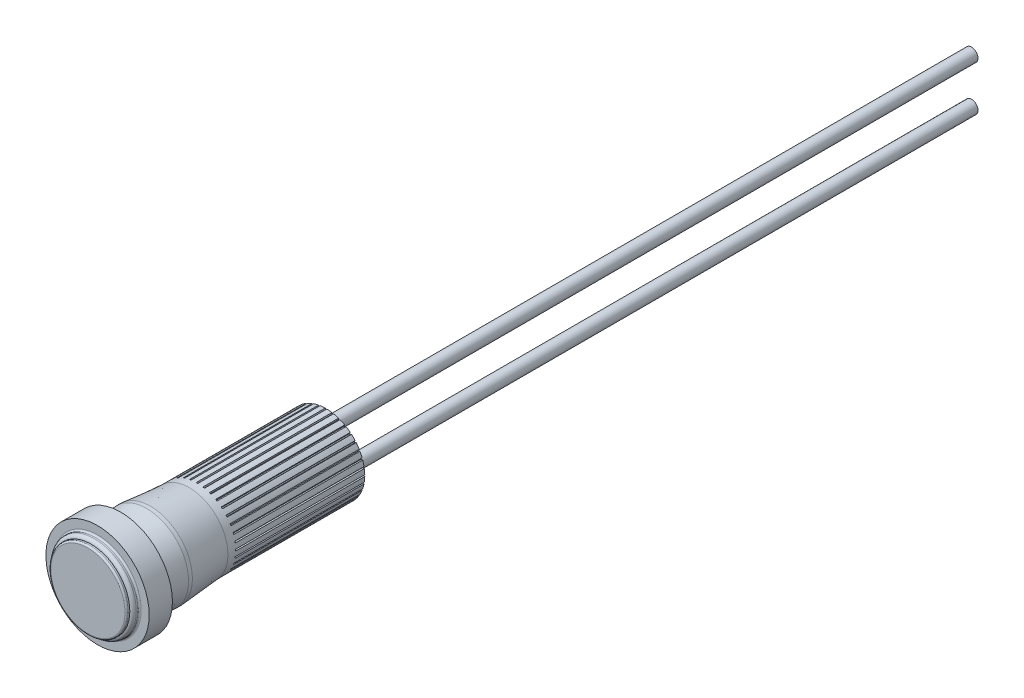
from build123d import *

# Parameters (mm, degrees)
SKETCH1_R           = 8
BOSS_EXTRUDE1_DEPTH = 5.1
CUT_EXTRUDE1_START  = -1.5
SKETCH2_R           = 8
SKETCH2_R_2         = 6.5
CUT_EXTRUDE1_DEPTH  = 1.5
SKETCH3_R           = 7
SKETCH3_R_2         = 6
CUT_EXTRUDE2_DEPTH  = 0.5
FILLET1_R           = 0.5
FILLET2_R           = 0.25
FILLET3_R           = 0.25
CUT_EXTRUDE3_DEPTH  = 20
SKETCH6_R           = 1
BOSS_EXTRUDE2_DEPTH = 100


with BuildPart() as part:
    # Sketch1 → Boss-Extrude1 (new body)
    with BuildSketch(Plane.XY):
        Circle(SKETCH1_R)
    extrude(amount=BOSS_EXTRUDE1_DEPTH)

    # Sketch2 → Cut-Extrude1 (cut)
    with BuildSketch(Plane.XY.offset(5.1).offset(CUT_EXTRUDE1_START)):
        Circle(SKETCH2_R)
        Circle(SKETCH2_R_2, mode=Mode.SUBTRACT)
    extrude(amount=CUT_EXTRUDE1_DEPTH, mode=Mode.SUBTRACT)

    # Sketch3 → Cut-Extrude2 (cut)
    with BuildSketch(Plane.XY.offset(5.1)):
        Circle(SKETCH3_R)
        Circle(SKETCH3_R_2, mode=Mode.SUBTRACT)
    extrude(amount=-CUT_EXTRUDE2_DEPTH, mode=Mode.SUBTRACT)

    # Fillet1
    fillet1_edges = [part.edges().sort_by_distance(p)[0] for p in [
        (-6.5, 0, 4.6),
    ]]
    fillet(fillet1_edges, radius=FILLET1_R - 0.0001)  # a hair under: the kernel refuses the full size

    # Fillet2
    fillet2_edges = [part.edges().sort_by_distance(p)[0] for p in [
        (-6, 0, 5.1),
    ]]
    fillet(fillet2_edges, radius=FILLET2_R)

    # Fillet3
    fillet3_edges = [part.edges().sort_by_distance(p)[0] for p in [
        (-6.5, 0, 3.6),
    ]]
    fillet(fillet3_edges, radius=FILLET3_R)

    # Sketch4 → Revolve1 (revolve)
    with BuildSketch(Plane(origin=(0, 0, 0), x_dir=(0, 0, -1), z_dir=(1, 0, 0)), mode=Mode.PRIVATE) as revolve1_sk:
        Polygon((0, 6), (4, 6.5), (4.6, 6.5), (10.6, 6), (31.8, 6), (31.8, 0), (0, 0), align=None)
    revolve(revolve1_sk.sketch.rotate(Axis((0, 0, 0), (0, 0, -1)), 90), axis=Axis((0, 0, 0), (0, 0, -1)))

    # Sketch5 → Cut-Extrude3 (cut)
    with BuildSketch(Plane(origin=(0, 0, -31.8), x_dir=(-1, 0, 0), z_dir=(0, 0, -1))):
        Polygon((0.918788097, 5.93055254), (1.164990035, 5.887140496), (1.072337603, 5.649620966), (0.92461644, 5.675668193), align=None)
        Polygon((-0.125, 6), (-0.075, 5.75), (0.075, 5.75), (0.125, 6), align=None)
        Polygon((1.934659282, 5.680908243), (2.169582438, 5.595403207), (2.037092771, 5.377581059), (1.896138878, 5.42888408), align=None)
        Polygon((2.891746825, 5.258652423), (3.108253175, 5.133652423), (2.939951905, 4.942146072), (2.810048095, 5.017146072), align=None)
        Polygon((3.760970103, 4.67661511), (3.952481214, 4.515918208), (3.753482089, 4.356546477), (3.638575422, 4.452964619), align=None)
        Polygon((4.515918208, 3.952481214), (4.67661511, 3.760970103), (4.452964619, 3.638575422), (4.356546477, 3.753482089), align=None)
        Polygon((5.133652423, 3.108253175), (5.258652423, 2.891746825), (5.017146072, 2.810048095), (4.942146072, 2.939951905), align=None)
        Polygon((5.595403207, 2.169582438), (5.680908243, 1.934659282), (5.42888408, 1.896138878), (5.377581059, 2.037092771), align=None)
        Polygon((5.887140496, 1.164990035), (5.93055254, 0.918788097), (5.675668193, 0.92461644), (5.649620966, 1.072337603), align=None)
        Polygon((6, 0.125), (6, -0.125), (5.75, -0.075), (5.75, 0.075), align=None)
        Polygon((5.93055254, -0.918788097), (5.887140496, -1.164990035), (5.649620966, -1.072337603), (5.675668193, -0.92461644), align=None)
        Polygon((5.680908243, -1.934659282), (5.595403207, -2.169582438), (5.377581059, -2.037092771), (5.42888408, -1.896138878), align=None)
        Polygon((5.258652423, -2.891746825), (5.133652423, -3.108253175), (4.942146072, -2.939951905), (5.017146072, -2.810048095), align=None)
        Polygon((4.67661511, -3.760970103), (4.515918208, -3.952481214), (4.356546477, -3.753482089), (4.452964619, -3.638575422), align=None)
        Polygon((3.952481214, -4.515918208), (3.760970103, -4.67661511), (3.638575422, -4.452964619), (3.753482089, -4.356546477), align=None)
        Polygon((3.108253175, -5.133652423), (2.891746825, -5.258652423), (2.810048095, -5.017146072), (2.939951905, -4.942146072), align=None)
        Polygon((2.169582438, -5.595403207), (1.934659282, -5.680908243), (1.896138878, -5.42888408), (2.037092771, -5.377581059), align=None)
        Polygon((1.164990035, -5.887140496), (0.918788097, -5.93055254), (0.92461644, -5.675668193), (1.072337603, -5.649620966), align=None)
        Polygon((0.125, -6), (-0.125, -6), (-0.075, -5.75), (0.075, -5.75), align=None)
        Polygon((-0.918788097, -5.93055254), (-1.164990035, -5.887140496), (-1.072337603, -5.649620966), (-0.92461644, -5.675668193), align=None)
        Polygon((-1.934659282, -5.680908243), (-2.169582438, -5.595403207), (-2.037092771, -5.377581059), (-1.896138878, -5.42888408), align=None)
        Polygon((-2.891746825, -5.258652423), (-3.108253175, -5.133652423), (-2.939951905, -4.942146072), (-2.810048095, -5.017146072), align=None)
        Polygon((-3.760970103, -4.67661511), (-3.952481214, -4.515918208), (-3.753482089, -4.356546477), (-3.638575422, -4.452964619), align=None)
        Polygon((-4.515918208, -3.952481214), (-4.67661511, -3.760970103), (-4.452964619, -3.638575422), (-4.356546477, -3.753482089), align=None)
        Polygon((-5.133652423, -3.108253175), (-5.258652423, -2.891746825), (-5.017146072, -2.810048095), (-4.942146072, -2.939951905), align=None)
        Polygon((-5.595403207, -2.169582438), (-5.680908243, -1.934659282), (-5.42888408, -1.896138878), (-5.377581059, -2.037092771), align=None)
        Polygon((-5.887140496, -1.164990035), (-5.93055254, -0.918788097), (-5.675668193, -0.92461644), (-5.649620966, -1.072337603), align=None)
        Polygon((-6, -0.125), (-6, 0.125), (-5.75, 0.075), (-5.75, -0.075), align=None)
        Polygon((-5.93055254, 0.918788097), (-5.887140496, 1.164990035), (-5.649620966, 1.072337603), (-5.675668193, 0.92461644), align=None)
        Polygon((-5.680908243, 1.934659282), (-5.595403207, 2.169582438), (-5.377581059, 2.037092771), (-5.42888408, 1.896138878), align=None)
        Polygon((-5.258652423, 2.891746825), (-5.133652423, 3.108253175), (-4.942146072, 2.939951905), (-5.017146072, 2.810048095), align=None)
        Polygon((-4.67661511, 3.760970103), (-4.515918208, 3.952481214), (-4.356546477, 3.753482089), (-4.452964619, 3.638575422), align=None)
        Polygon((-3.952481214, 4.515918208), (-3.760970103, 4.67661511), (-3.638575422, 4.452964619), (-3.753482089, 4.356546477), align=None)
        Polygon((-3.108253175, 5.133652423), (-2.891746825, 5.258652423), (-2.810048095, 5.017146072), (-2.939951905, 4.942146072), align=None)
        Polygon((-2.169582438, 5.595403207), (-1.934659282, 5.680908243), (-1.896138878, 5.42888408), (-2.037092771, 5.377581059), align=None)
        Polygon((-1.164990035, 5.887140496), (-0.918788097, 5.93055254), (-0.92461644, 5.675668193), (-1.072337603, 5.649620966), align=None)
    extrude(amount=-CUT_EXTRUDE3_DEPTH, mode=Mode.SUBTRACT)

    # Sketch6 → Boss-Extrude2 (add)
    with BuildSketch(Plane(origin=(0, 0, -31.8), x_dir=(-1, 0, 0), z_dir=(0, 0, -1))):
        with Locations(Location((0, 3.5, 0), (0, 0, 180))):
            Circle(SKETCH6_R)
        with Locations(Location((0, -3.5, 0), (0, 0, 180))):
            Circle(SKETCH6_R)
    extrude(amount=BOSS_EXTRUDE2_DEPTH)


solid = part.part
